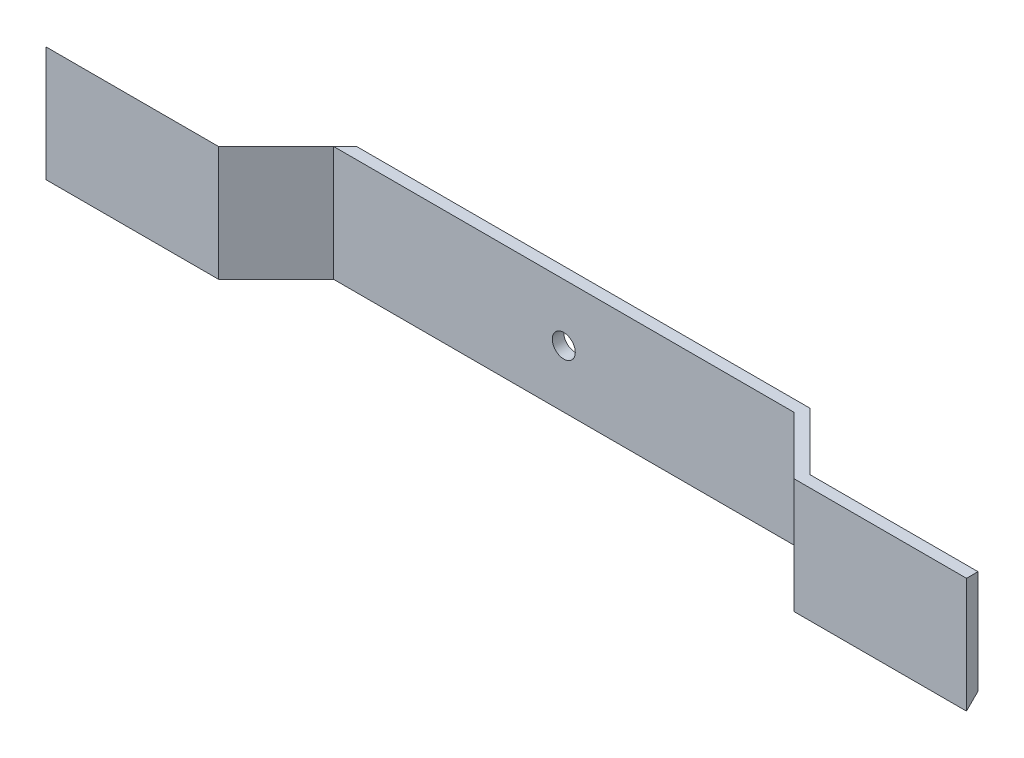
from build123d import *

# Parameters (mm, degrees)
BOTTOM_BLADE_EXTRUDE_DEPTH        = 10
BOTTOM_BLADE_CUT_1_SIZE           = 1
BOTTOM_BLADE_CUT_2_SIZE           = 1
SKETCH3_R                         = 1
HOLE_FOR_SCREW_BOTTOM_BLADE_DEPTH = 20


with BuildPart() as part:
    # Sketch2 → Bottom Blade Extrude (new body)
    with BuildSketch(Plane(origin=(0, 0, 0), x_dir=(1, 0, 0), z_dir=(0, 1, 0))):
        Polygon((-27.237322503, 0), (12.762677497, 0), (17.762677497, -5), (32.762677497, -5), (32.762677497, -4), (18.17689106, -4), (13.17689106, 1), (-27.651536065, 1), (-32.651536065, -4), (-47.237322503, -4), (-47.237322503, -5), (-32.237322503, -5), align=None)
    extrude(amount=BOTTOM_BLADE_EXTRUDE_DEPTH)

    # Bottom Blade Cut 1
    bottom_blade_cut_1_edges = [part.edges().sort_by_distance(p)[0] for p in [
        (-30.151536065, 10, 1.5),
        (-39.944429284, 10, 4),
    ]]
    chamfer(bottom_blade_cut_1_edges, length=BOTTOM_BLADE_CUT_1_SIZE - 0.0001)  # a hair under: the kernel refuses the full size

    # Bottom Blade Cut 2
    bottom_blade_cut_2_edges = [part.edges().sort_by_distance(p)[0] for p in [
        (15.67689106, 0, 1.5),
        (25.469784279, 0, 4),
    ]]
    chamfer(bottom_blade_cut_2_edges, length=BOTTOM_BLADE_CUT_2_SIZE - 0.0001)  # a hair under: the kernel refuses the full size

    # Sketch3 → Hole for Screw ( Bottom Blade) (cut)
    with BuildSketch(Plane.XY):
        with Locations((-7.237322503, 5)):
            Circle(SKETCH3_R)
    extrude(amount=-HOLE_FOR_SCREW_BOTTOM_BLADE_DEPTH, mode=Mode.SUBTRACT)


solid = part.part
